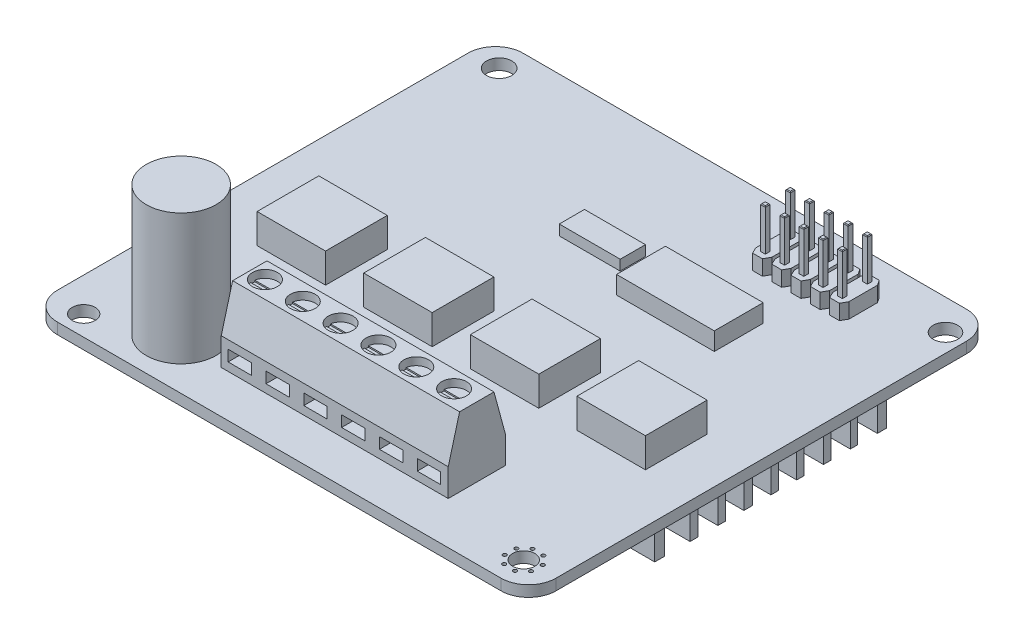
from build123d import *
from build123d.topology import SkipClean

# Parameters (mm, degrees)
SALIENTE_EXTRUIR1_DEPTH = 1.6
CROQUIS2_W              = 9.953458247
CROQUIS2_H              = 8.971209078
SALIENTE_EXTRUIR2_DEPTH = 4.3
CROQUIS3_W              = 8.86308706
CROQUIS3_H              = 3.667484301
SALIENTE_EXTRUIR3_DEPTH = 1.5
CROQUIS4_W              = 14.211501665
CROQUIS4_H              = 7.105750833
SALIENTE_EXTRUIR4_DEPTH = 2.6
CROQUIS5_R              = 1.665422678
CROQUIS5_R_2            = 1.837208801
CROQUIS5_R_3            = 1.779609239
CROQUIS5_R_4            = 1.616609907
CROQUIS5_R_5            = 0.269998692
CORTAR_EXTRUIR1_DEPTH   = 2.6
SALIENTE_EXTRUIR5_DEPTH = 33
CROQUIS9_R              = 5.075
SALIENTE_EXTRUIR6_DEPTH = 19
SALIENTE_EXTRUIR7_DEPTH = 2.2
CROQUIS11_W             = 0.7
CROQUIS11_H             = 0.7
SALIENTE_EXTRUIR8_DEPTH = 6
CHAFL_N1_SIZE           = 0.1
CHAFL_N2_SIZE           = 0.1
CHAFL_N3_SIZE           = 0.1
CROQUIS12_R             = 1.8
CORTAR_EXTRUIR2_DEPTH   = 1.12
CORTAR_EXTRUIR3_DEPTH   = 0.2
CROQUIS14_W             = 3.4
CROQUIS14_H             = 1.6
CORTAR_EXTRUIR4_DEPTH   = 7
SALIENTE_EXTRUIR9_DEPTH = 63


# Read off the part's stored shape, not the designer's step: Saliente-Extruir11
with BuildPart() as part:
    # Croquis1 → Saliente-Extruir1 (new body)
    with BuildSketch(Plane(origin=(0, 0, 0), x_dir=(1, 0, 0), z_dir=(0, 1, 0))):
        with BuildLine():
            Line((-32.25, -33.85), (32.25, -33.85))
            ThreePointArc((32.25, -33.85), (35.078427125, -32.678427125), (36.25, -29.85))
            Line((36.25, -29.85), (36.25, 29.85))
            ThreePointArc((36.25, 29.85), (35.078427125, 32.678427125), (32.25, 33.85))
            Line((32.25, 33.85), (-32.25, 33.85))
            ThreePointArc((-32.25, 33.85), (-35.078427125, 32.678427125), (-36.25, 29.85))
            Line((-36.25, 29.85), (-36.25, -29.85))
            ThreePointArc((-36.25, -29.85), (-35.078427125, -32.678427125), (-32.25, -33.85))
        make_face()
    extrude(amount=SALIENTE_EXTRUIR1_DEPTH)

    # Croquis2 → Saliente-Extruir2 (add)
    with BuildSketch(Plane(origin=(0, 1.6, 0), x_dir=(1, 0, 0), z_dir=(0, 1, 0))):
        with Locations((-6.864009392, -5.231123149)):
            Rectangle(CROQUIS2_W, CROQUIS2_H)
        with Locations((-22.364009393, -5.231123149)):
            Rectangle(CROQUIS2_W, CROQUIS2_H)
        with Locations((8.635990608, -5.231123149)):
            Rectangle(CROQUIS2_W, CROQUIS2_H)
        with Locations((24.135990608, -5.231123149)):
            Rectangle(CROQUIS2_W, CROQUIS2_H)
    extrude(amount=SALIENTE_EXTRUIR2_DEPTH)

    # Croquis3 → Saliente-Extruir3 (add)
    with BuildSketch(Plane(origin=(0, 1.6, 0), x_dir=(1, 0, 0), z_dir=(0, 1, 0))):
        with Locations((-2.171792748, 15.307422689)):
            Rectangle(CROQUIS3_W, CROQUIS3_H)
    extrude(amount=SALIENTE_EXTRUIR3_DEPTH)

    # Croquis4 → Saliente-Extruir4 (add)
    with BuildSketch(Plane(origin=(0, 1.6, 0), x_dir=(1, 0, 0), z_dir=(0, 1, 0))):
        with Locations((12.116114839, 13.741101268)):
            Rectangle(CROQUIS4_W, CROQUIS4_H)
    extrude(amount=SALIENTE_EXTRUIR4_DEPTH)

    # Croquis5 → Cortar-Extruir1 (cut)
    with BuildSketch(Plane(origin=(0, 1.6, 0), x_dir=(1, 0, 0), z_dir=(0, 1, 0))):
        with Locations(Location((-31.351166776, -30.918670379, 0), (0, 0, 270))):
            Circle(CROQUIS5_R)
        with Locations(Location((-32.088362039, 30.220961647, 0), (0, 0, 270))):
            Circle(CROQUIS5_R_2)
        with Locations(Location((33.60571352, 29.414060145, 0), (0, 0, 270))):
            Circle(CROQUIS5_R_3)
        with Locations(Location((31.599274648, -29.894360742, 0), (0, 0, 270))):
            Circle(CROQUIS5_R_4)
        with Locations(Location((29.642657046, -29.003431548, 0), (0, 0, 270))):
            Circle(CROQUIS5_R_5)
        with Locations(Location((30.845719149, -27.880841093, 0), (0, 0, 270))):
            Circle(CROQUIS5_R_5)
        with Locations(Location((32.490203843, -27.93774314, 0), (0, 0, 270))):
            Circle(CROQUIS5_R_5)
        with Locations(Location((33.612794298, -29.140805243, 0), (0, 0, 270))):
            Circle(CROQUIS5_R_5)
        with Locations(Location((33.55589225, -30.785289937, 0), (0, 0, 270))):
            Circle(CROQUIS5_R_5)
        with Locations(Location((32.352830148, -31.907880392, 0), (0, 0, 270))):
            Circle(CROQUIS5_R_5)
        with Locations(Location((30.708345454, -31.850978344, 0), (0, 0, 270))):
            Circle(CROQUIS5_R_5)
        with Locations(Location((29.585754999, -30.647916242, 0), (0, 0, 270))):
            Circle(CROQUIS5_R_5)
    extrude(amount=-CORTAR_EXTRUIR1_DEPTH, mode=Mode.SUBTRACT)

    # Croquis8 → Saliente-Extruir5 (add)
    with BuildSketch(Plane.ZY.offset(14.608594996)):
        Polygon((19.361397941, 1.6), (27.661397941, 1.6), (27.661397941, 5.6), (26.011397941, 11.7), (21.011397941, 11.7), (19.361397941, 5.6), align=None)
    extrude(amount=-SALIENTE_EXTRUIR5_DEPTH)

    # Croquis9 → Saliente-Extruir6 (add)
    with BuildSketch(Plane(origin=(0, 1.6, 0), x_dir=(1, 0, 0), z_dir=(0, 1, 0))):
        with Locations(Location((-21.559482801, -26.539835749, 0), (0, 0, 90))):
            Circle(CROQUIS9_R)
    extrude(amount=SALIENTE_EXTRUIR6_DEPTH)

    # Croquis10 → Saliente-Extruir7 (add)
    with BuildSketch(Plane(origin=(0, 1.6, 0), x_dir=(1, 0, 0), z_dir=(0, 1, 0))):
        Polygon((24.93125741, 24.04928706), (24.437785316, 23.164528256), (23.008497758, 23.164528256), (22.588543452, 24.04928706), (22.588543452, 28.190151786), (23.008497758, 28.943098659), (24.437785316, 28.943098659), (24.93125741, 28.190151786), align=None)
        Polygon((21.637785316, 23.164528256), (20.208497758, 23.164528256), (19.788543452, 24.04928706), (19.788543452, 28.190151786), (20.208497758, 28.943098659), (21.637785316, 28.943098659), (22.13125741, 28.190151786), (22.13125741, 24.04928706), align=None)
        Polygon((18.837785316, 23.164528256), (17.408497758, 23.164528256), (16.988543452, 24.04928706), (16.988543452, 28.190151786), (17.408497758, 28.943098659), (18.837785316, 28.943098659), (19.33125741, 28.190151786), (19.33125741, 24.04928706), align=None)
        Polygon((16.037785316, 23.164528256), (14.608497758, 23.164528256), (14.188543452, 24.04928706), (14.188543452, 28.190151786), (14.608497758, 28.943098659), (16.037785316, 28.943098659), (16.53125741, 28.190151786), (16.53125741, 24.04928706), align=None)
        Polygon((13.237785316, 23.164528256), (11.808497758, 23.164528256), (11.388543452, 24.04928706), (11.388543452, 28.190151786), (11.808497758, 28.943098659), (13.237785316, 28.943098659), (13.73125741, 28.190151786), (13.73125741, 24.04928706), align=None)
    extrude(amount=SALIENTE_EXTRUIR7_DEPTH)

    # Croquis11 → Saliente-Extruir8 (add)
    with BuildSketch(Plane(origin=(0, 3.8, 0), x_dir=(1, 0, 0), z_dir=(0, 1, 0))):
        with Locations((23.723141537, 24.303102839)):
            Rectangle(CROQUIS11_W, CROQUIS11_H)
        with Locations((23.723141537, 27.936336007)):
            Rectangle(CROQUIS11_W, CROQUIS11_H)
        with Locations((20.923141537, 27.936336007)):
            Rectangle(CROQUIS11_W, CROQUIS11_H)
        with Locations((20.923141537, 24.303102839)):
            Rectangle(CROQUIS11_W, CROQUIS11_H)
        with Locations((18.123141537, 27.936336007)):
            Rectangle(CROQUIS11_W, CROQUIS11_H)
        with Locations((18.123141537, 24.303102839)):
            Rectangle(CROQUIS11_W, CROQUIS11_H)
        with Locations((15.323141537, 27.936336007)):
            Rectangle(CROQUIS11_W, CROQUIS11_H)
        with Locations((15.323141537, 24.303102839)):
            Rectangle(CROQUIS11_W, CROQUIS11_H)
        with Locations((12.523141537, 27.936336007)):
            Rectangle(CROQUIS11_W, CROQUIS11_H)
        with Locations((12.523141537, 24.303102839)):
            Rectangle(CROQUIS11_W, CROQUIS11_H)
    extrude(amount=SALIENTE_EXTRUIR8_DEPTH)

    # Chaflán1
    chafl_n1_edges = [part.edges().sort_by_distance(p)[0] for p in [
        (18.473141537, 9.8, -27.936336007),
        (18.123141537, 9.8, -28.286336007),
        (17.773141537, 9.8, -27.936336007),
        (18.123141537, 9.8, -27.586336007),
    ]]
    chamfer(chafl_n1_edges, length=CHAFL_N1_SIZE)

    # Chaflán2
    chafl_n2_edges = [part.edges().sort_by_distance(p)[0] for p in [
        (23.373141537, 9.8, -24.303102839),
        (23.723141537, 9.8, -23.953102839),
        (24.073141537, 9.8, -24.303102839),
        (23.723141537, 9.8, -24.653102839),
    ]]
    chamfer(chafl_n2_edges, length=CHAFL_N2_SIZE)

    # Chaflán3
    chafl_n3_edges = [part.edges().sort_by_distance(p)[0] for p in [
        (23.723141537, 9.8, -27.586336007),
        (24.073141537, 9.8, -27.936336007),
        (23.723141537, 9.8, -28.286336007),
        (23.373141537, 9.8, -27.936336007),
        (20.573141537, 9.8, -24.303102839),
        (20.923141537, 9.8, -23.953102839),
        (21.273141537, 9.8, -24.303102839),
        (20.923141537, 9.8, -24.653102839),
        (21.273141537, 9.8, -27.936336007),
        (20.923141537, 9.8, -28.286336007),
        (20.573141537, 9.8, -27.936336007),
        (20.923141537, 9.8, -27.586336007),
        (17.773141537, 9.8, -24.303102839),
        (18.123141537, 9.8, -23.953102839),
        (18.473141537, 9.8, -24.303102839),
        (18.123141537, 9.8, -24.653102839),
        (14.973141537, 9.8, -24.303102839),
        (15.323141537, 9.8, -23.953102839),
        (15.673141537, 9.8, -24.303102839),
        (15.323141537, 9.8, -24.653102839),
        (15.673141537, 9.8, -27.936336007),
        (15.323141537, 9.8, -28.286336007),
        (14.973141537, 9.8, -27.936336007),
        (15.323141537, 9.8, -27.586336007),
        (12.173141537, 9.8, -24.303102839),
        (12.523141537, 9.8, -23.953102839),
        (12.873141537, 9.8, -24.303102839),
        (12.523141537, 9.8, -24.653102839),
        (12.873141537, 9.8, -27.936336007),
        (12.523141537, 9.8, -28.286336007),
        (12.173141537, 9.8, -27.936336007),
        (12.523141537, 9.8, -27.586336007),
    ]]
    chamfer(chafl_n3_edges, length=CHAFL_N3_SIZE)

    # Croquis12 → Cortar-Extruir2 (cut)
    with BuildSketch(Plane(origin=(0, 11.7, 0), x_dir=(1, 0, 0), z_dir=(0, 1, 0))):
        with Locations(Location((-12.405064018, -23.511397941, 0), (0, 0, 270))):
            Circle(CROQUIS12_R)
        with Locations(Location((-6.905064018, -23.511397941, 0), (0, 0, 270))):
            Circle(CROQUIS12_R)
        with Locations(Location((-1.405064018, -23.511397941, 0), (0, 0, 270))):
            Circle(CROQUIS12_R)
        with Locations(Location((4.094935982, -23.511397941, 0), (0, 0, 270))):
            Circle(CROQUIS12_R)
        with Locations(Location((9.594935982, -23.511397941, 0), (0, 0, 270))):
            Circle(CROQUIS12_R)
        with Locations(Location((15.094935982, -23.511397941, 0), (0, 0, 270))):
            Circle(CROQUIS12_R)
    extrude(amount=-CORTAR_EXTRUIR2_DEPTH, mode=Mode.SUBTRACT)

    # Croquis13 → Cortar-Extruir3 (cut)
    with SkipClean():  # the faces are left unmerged after this step: merging them gives an invalid solid
        with BuildSketch(Plane(origin=(0, 10.58, 0), x_dir=(1, 0, 0), z_dir=(0, 1, 0))):
            with BuildLine():
                Line((-14.179887952, -23.211397941), (-10.630240083, -23.211397941))
                ThreePointArc((-10.630240083, -23.211397941), (-10.605064018, -23.511397941), (-10.630240083, -23.811397941))
                Line((-10.630240083, -23.811397941), (-14.179887952, -23.811397941))
                ThreePointArc((-14.179887952, -23.811397941), (-14.205064018, -23.511397941), (-14.179887952, -23.211397941))
            make_face()
            with BuildLine():
                Line((-8.679887952, -23.211397941), (-5.130240083, -23.211397941))
                ThreePointArc((-5.130240083, -23.211397941), (-5.105064018, -23.511397941), (-5.130240083, -23.811397941))
                Line((-5.130240083, -23.811397941), (-8.679887952, -23.811397941))
                ThreePointArc((-8.679887952, -23.811397941), (-8.705064018, -23.511397941), (-8.679887952, -23.211397941))
            make_face()
            with BuildLine():
                Line((-3.179887952, -23.211397941), (0.369759917, -23.211397941))
                ThreePointArc((0.369759917, -23.211397941), (0.394935982, -23.511397941), (0.369759917, -23.811397941))
                Line((0.369759917, -23.811397941), (-3.179887952, -23.811397941))
                ThreePointArc((-3.179887952, -23.811397941), (-3.205064018, -23.511397941), (-3.179887952, -23.211397941))
            make_face()
            with BuildLine():
                Line((2.320112048, -23.211397941), (5.869759917, -23.211397941))
                ThreePointArc((5.869759917, -23.211397941), (5.894935982, -23.511397941), (5.869759917, -23.811397941))
                Line((5.869759917, -23.811397941), (2.320112048, -23.811397941))
                ThreePointArc((2.320112048, -23.811397941), (2.294935982, -23.511397941), (2.320112048, -23.211397941))
            make_face()
            with BuildLine():
                Line((7.820112048, -23.211397941), (11.369759917, -23.211397941))
                ThreePointArc((11.369759917, -23.211397941), (11.394935982, -23.511397941), (11.369759917, -23.811397941))
                Line((11.369759917, -23.811397941), (7.820112048, -23.811397941))
                ThreePointArc((7.820112048, -23.811397941), (7.794935982, -23.511397941), (7.820112048, -23.211397941))
            make_face()
            with BuildLine():
                Line((13.320112048, -23.211397941), (16.869759917, -23.211397941))
                ThreePointArc((16.869759917, -23.211397941), (16.894935982, -23.511397941), (16.869759917, -23.811397941))
                Line((16.869759917, -23.811397941), (13.320112048, -23.811397941))
                ThreePointArc((13.320112048, -23.811397941), (13.294935982, -23.511397941), (13.320112048, -23.211397941))
            make_face()
        extrude(amount=-CORTAR_EXTRUIR3_DEPTH, mode=Mode.SUBTRACT)

    # Croquis14 → Cortar-Extruir4 (cut)
    with SkipClean():  # the faces are left unmerged after this step: merging them gives an invalid solid
        with BuildSketch(Plane.XY.offset(27.661397941)):
            with Locations((-11.908594996, 3.6)):
                Rectangle(CROQUIS14_W, CROQUIS14_H)
            with Locations((-6.408594996, 3.6)):
                Rectangle(CROQUIS14_W, CROQUIS14_H)
            with Locations((-0.908594996, 3.6)):
                Rectangle(CROQUIS14_W, CROQUIS14_H)
            with Locations((4.591405004, 3.6)):
                Rectangle(CROQUIS14_W, CROQUIS14_H)
            with Locations((10.091405004, 3.6)):
                Rectangle(CROQUIS14_W, CROQUIS14_H)
            with Locations((15.591405004, 3.6)):
                Rectangle(CROQUIS14_W, CROQUIS14_H)
        extrude(amount=-CORTAR_EXTRUIR4_DEPTH, mode=Mode.SUBTRACT)

    # Croquis16 → Saliente-Extruir9 (add)
    with SkipClean():  # the faces are left unmerged after this step: merging them gives an invalid solid
        with BuildSketch(Plane(origin=(31.5, 0, 0), x_dir=(0, 0, -1), z_dir=(1, 0, 0))):
            Polygon((22.939420037, 0), (22.939420037, -8.287350575), (21.616440053, -8.287350575), (21.616440053, -1.448843327), (20.698499593, -1.448843327), (20.698499593, -0.888467549), (19.514341822, -0.888467549), (19.514341822, -1.448843327), (18.700492057, -1.448843327), (18.700492057, -8.287350575), (17.682199391, -8.287350575), (17.682199391, -0.888467549), (14.869103087, -0.888467549), (14.869103087, -8.287350575), (13.781326176, -8.287350575), (13.781326176, -0.888467549), (10.970319163, -0.888467549), (10.970319163, -8.287350575), (9.891987615, -8.287350575), (9.891987615, -0.888467549), (7.215285354, -0.888467549), (7.215285354, -8.287350575), (6.139982777, -8.287350575), (6.139982777, -0.888467549), (3.469338458, -0.888467549), (3.469338458, -8.287350575), (2.211353769, -8.287350575), (2.211353769, -0.888467549), (-0.49612987, -0.888467549), (-0.49612987, -8.287350575), (-1.574461418, -8.287350575), (-1.574461418, -0.888467549), (-4.455540256, -0.888467549), (-4.455540256, -8.287350575), (-5.609143896, -8.287350575), (-5.609143896, -1.448843327), (-6.58334531, -1.448843327), (-6.58334531, -0.888467549), (-8.25516968, -0.888467549), (-8.25516968, -1.448843327), (-9.325436897, -1.448843327), (-9.325436897, -8.287350575), (-10.752704998, -8.287350575), (-10.752704998, 0), align=None)
        extrude(amount=-SALIENTE_EXTRUIR9_DEPTH)

    # Saliente-Extruir10 cone 1 section (through the dimple's axis) → Saliente-Extruir10 (revolve)
    with SkipClean():  # the faces are left unmerged after this step: merging them gives an invalid solid
        with BuildSketch(Plane(origin=(-13.019235761, 0, 21.635032581), x_dir=(0, 0, 1), z_dir=(1, 0, 0))):
            Polygon((0, 0), (1.442311236, 0), (0, 1.781106045), align=None)
        revolve(axis=Axis((-13.019235761, 0, 21.635032581), (0, -1, 0)))

    # Saliente-Extruir10 cone 2 section (through the dimple's axis) → Saliente-Extruir10 cone 2 (revolve)
    with SkipClean():  # the faces are left unmerged after this step: merging them gives an invalid solid
        with BuildSketch(Plane(origin=(-7.819235761, 0, 21.635032581), x_dir=(0, 0, 1), z_dir=(1, 0, 0))):
            Polygon((0, 0), (1.442311236, 0), (0, 1.781106045), align=None)
        revolve(axis=Axis((-7.819235761, 0, 21.635032581), (0, -1, 0)))

    # Saliente-Extruir10 cone 3 section (through the dimple's axis) → Saliente-Extruir10 cone 3 (revolve)
    with SkipClean():  # the faces are left unmerged after this step: merging them gives an invalid solid
        with BuildSketch(Plane(origin=(-2.619235761, 0, 21.635032581), x_dir=(0, 0, 1), z_dir=(1, 0, 0))):
            Polygon((0, 0), (1.442311236, 0), (0, 1.781106045), align=None)
        revolve(axis=Axis((-2.619235761, 0, 21.635032581), (0, -1, 0)))

    # Saliente-Extruir10 cone 4 section (through the dimple's axis) → Saliente-Extruir10 cone 4 (revolve)
    with SkipClean():  # the faces are left unmerged after this step: merging them gives an invalid solid
        with BuildSketch(Plane(origin=(2.580764239, 0, 21.635032581), x_dir=(0, 0, 1), z_dir=(1, 0, 0))):
            Polygon((0, 0), (1.442311236, 0), (0, 1.781106045), align=None)
        revolve(axis=Axis((2.580764239, 0, 21.635032581), (0, -1, 0)))

    # Saliente-Extruir10 cone 5 section (through the dimple's axis) → Saliente-Extruir10 cone 5 (revolve)
    with SkipClean():  # the faces are left unmerged after this step: merging them gives an invalid solid
        with BuildSketch(Plane(origin=(7.780764239, 0, 21.635032581), x_dir=(0, 0, 1), z_dir=(1, 0, 0))):
            Polygon((0, 0), (1.442311236, 0), (0, 1.781106045), align=None)
        revolve(axis=Axis((7.780764239, 0, 21.635032581), (0, -1, 0)))

    # Saliente-Extruir10 cone 6 section (through the dimple's axis) → Saliente-Extruir10 cone 6 (revolve)
    with SkipClean():  # the faces are left unmerged after this step: merging them gives an invalid solid
        with BuildSketch(Plane(origin=(12.980764239, 0, 21.635032581), x_dir=(0, 0, 1), z_dir=(1, 0, 0))):
            Polygon((0, 0), (1.442311236, 0), (0, 1.781106045), align=None)
        revolve(axis=Axis((12.980764239, 0, 21.635032581), (0, -1, 0)))

    # Saliente-Extruir11 outline → Saliente-Extruir11 (revolve)
    with SkipClean():  # the faces are left unmerged after this step: merging them gives an invalid solid
        with BuildSketch(Plane(origin=(23.027141573, 0, -27.238054752), x_dir=(1, 0, 0), z_dir=(0, 0, 1))):
            Polygon((0, -0.9), (0.048218524, -0.9), (0.948218524, 0), (0, 0), align=None)
        revolve(axis=Axis((23.027141573, 0, -27.238054752), (0, 1, 0)))

    # Saliente-Extruir11 2 outline → Saliente-Extruir11 2 (revolve)
    with SkipClean():  # the faces are left unmerged after this step: merging them gives an invalid solid
        with BuildSketch(Plane(origin=(20.508712446, 0, -27.140841714), x_dir=(1, 0, 0), z_dir=(0, 0, 1))):
            Polygon((0, 0), (0, -0.9), (0.037108431, -0.9), (0.937108431, 0), align=None)
        revolve(axis=Axis((20.508712446, 0, -27.140841714), (0, 1, 0)))

    # Saliente-Extruir11 3 outline → Saliente-Extruir11 3 (revolve)
    with SkipClean():  # the faces are left unmerged after this step: merging them gives an invalid solid
        with BuildSketch(Plane(origin=(17.004699898, 0, -27.141137727), x_dir=(1, 0, 0), z_dir=(0, 0, 1))):
            Polygon((0, 0), (0, -0.9), (0.04213444, -0.9), (0.94213444, 0), align=None)
        revolve(axis=Axis((17.004699898, 0, -27.141137727), (0, 1, 0)))

    # Saliente-Extruir11 4 outline → Saliente-Extruir11 4 (revolve)
    with SkipClean():  # the faces are left unmerged after this step: merging them gives an invalid solid
        with BuildSketch(Plane(origin=(14.384023451, 0, -27.0746396), x_dir=(1, 0, 0), z_dir=(0, 0, 1))):
            Polygon((0, 0), (0, -0.9), (0.022570808, -0.9), (0.922570808, 0), align=None)
        revolve(axis=Axis((14.384023451, 0, -27.0746396), (0, 1, 0)))

    # Saliente-Extruir11 5 outline → Saliente-Extruir11 5 (revolve)
    with SkipClean():  # the faces are left unmerged after this step: merging them gives an invalid solid
        with BuildSketch(Plane(origin=(11.849234341, 0, -27.116819583), x_dir=(1, 0, 0), z_dir=(0, 0, 1))):
            Polygon((0, 0), (0, -0.9), (0.023114524, -0.9), (0.923114524, 0), align=None)
        revolve(axis=Axis((11.849234341, 0, -27.116819583), (0, 1, 0)))

    # Saliente-Extruir11 6 outline → Saliente-Extruir11 6 (revolve)
    with SkipClean():  # the faces are left unmerged after this step: merging them gives an invalid solid
        with BuildSketch(Plane(origin=(23.027141573, 0, -29.738054752), x_dir=(1, 0, 0), z_dir=(0, 0, 1))):
            Polygon((0, 0), (0, -0.9), (0.048218524, -0.9), (0.948218524, 0), align=None)
        revolve(axis=Axis((23.027141573, 0, -29.738054752), (0, 1, 0)))

    # Saliente-Extruir11 7 outline → Saliente-Extruir11 7 (revolve)
    with SkipClean():  # the faces are left unmerged after this step: merging them gives an invalid solid
        with BuildSketch(Plane(origin=(20.508712446, 0, -29.640841714), x_dir=(1, 0, 0), z_dir=(0, 0, 1))):
            Polygon((0, 0), (0, -0.9), (0.037108431, -0.9), (0.937108431, 0), align=None)
        revolve(axis=Axis((20.508712446, 0, -29.640841714), (0, 1, 0)))

    # Saliente-Extruir11 8 outline → Saliente-Extruir11 8 (revolve)
    with SkipClean():  # the faces are left unmerged after this step: merging them gives an invalid solid
        with BuildSketch(Plane(origin=(17.004699898, 0, -29.641137727), x_dir=(1, 0, 0), z_dir=(0, 0, 1))):
            Polygon((0, 0), (0, -0.9), (0.04213444, -0.9), (0.94213444, 0), align=None)
        revolve(axis=Axis((17.004699898, 0, -29.641137727), (0, 1, 0)))

    # Saliente-Extruir11 9 outline → Saliente-Extruir11 9 (revolve)
    with SkipClean():  # the faces are left unmerged after this step: merging them gives an invalid solid
        with BuildSketch(Plane(origin=(14.384023451, 0, -29.5746396), x_dir=(1, 0, 0), z_dir=(0, 0, 1))):
            Polygon((0, 0), (0, -0.9), (0.022570808, -0.9), (0.922570808, 0), align=None)
        revolve(axis=Axis((14.384023451, 0, -29.5746396), (0, 1, 0)))

    # Saliente-Extruir11 10 outline → Saliente-Extruir11 10 (revolve)
    with SkipClean():  # the faces are left unmerged after this step: merging them gives an invalid solid
        with BuildSketch(Plane(origin=(11.849234341, 0, -29.616819583), x_dir=(1, 0, 0), z_dir=(0, 0, 1))):
            Polygon((0, 0), (0, -0.9), (0.023114524, -0.9), (0.923114524, 0), align=None)
        revolve(axis=Axis((11.849234341, 0, -29.616819583), (0, 1, 0)))

    # Saliente-Extruir11 11 outline → Saliente-Extruir11 11 (revolve)
    with SkipClean():  # the faces are left unmerged after this step: merging them gives an invalid solid
        with BuildSketch(Plane(origin=(-19.665336002, 0, 25.588081123), x_dir=(1, 0, 0), z_dir=(0, 0, 1))):
            Polygon((0, 0), (0, -0.9), (0.9, 0), align=None)
        revolve(axis=Axis((-19.665336002, 0, 25.588081123), (0, 1, 0)))

    # Saliente-Extruir11 12 outline → Saliente-Extruir11 12 (revolve)
    with SkipClean():  # the faces are left unmerged after this step: merging them gives an invalid solid
        with BuildSketch(Plane(origin=(-24.626021926, 0, 25.492165563), x_dir=(1, 0, 0), z_dir=(0, 0, 1))):
            Polygon((0, 0), (0, -0.9), (0.9, 0), align=None)
        revolve(axis=Axis((-24.626021926, 0, 25.492165563), (0, 1, 0)))


solid = part.part
